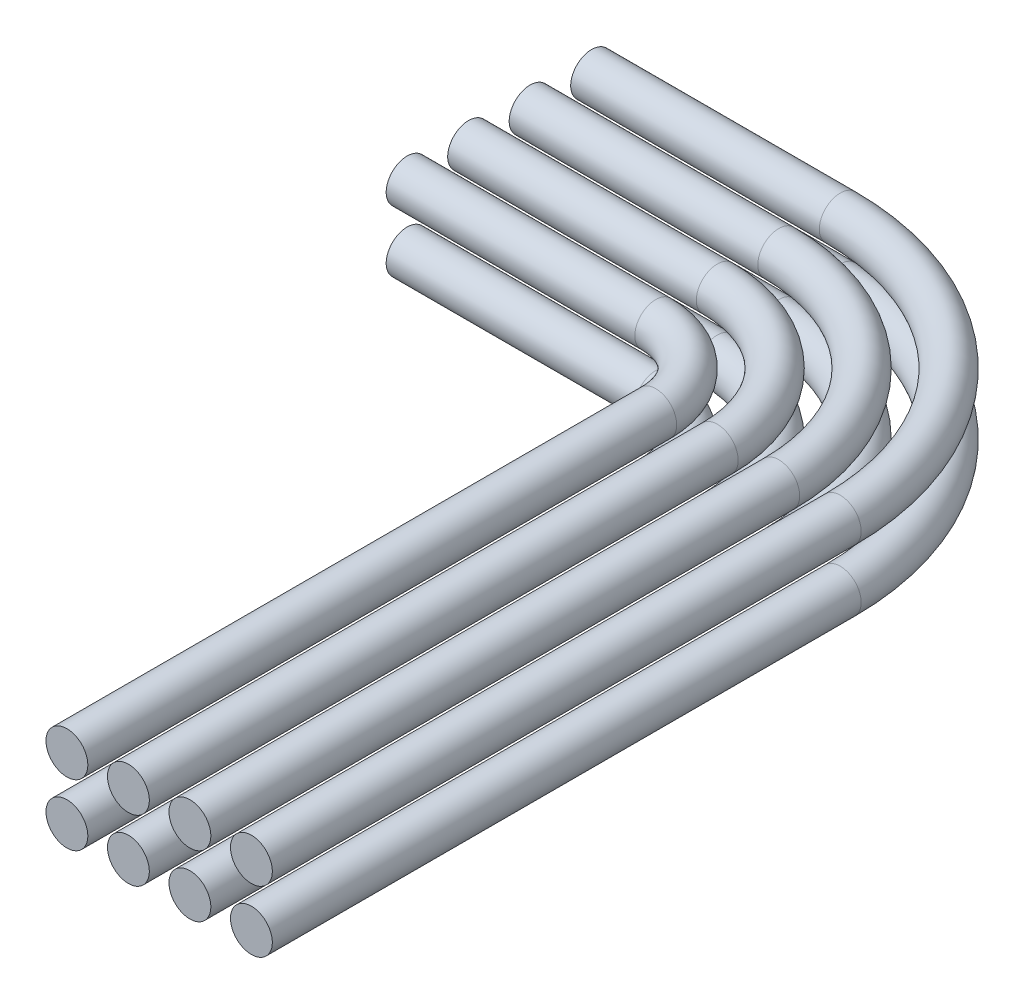
from build123d import *

# Parameters (mm, degrees)
SKETCH2_R       = 1.6
LPATTERN1_COUNT = 2
LPATTERN1_PITCH = 4.7


with BuildPart() as part:
    # Sweep1: sweep along a path in Sketch1
    with BuildLine(Plane(origin=(0, 0, 0), x_dir=(1, 0, 0), z_dir=(0, 1, 0))) as sweep1_path:
        Line((0, 0), (19, 0))
        ThreePointArc((19, 0), (33.142135624, -5.857864376), (39, -20))
        Line((39, -20), (39, -65))
    # Sketch2 → Sweep1 (sweep)
    with BuildSketch(Plane(origin=(0, 0, 0), x_dir=(0, 0, -1), z_dir=(1, 0, 0))):
        Circle(SKETCH2_R)
        with Locations((-4.7, 0)):
            Circle(SKETCH2_R)
        with Locations((-9.4, 0)):
            Circle(SKETCH2_R)
        with Locations((-14.1, 0)):
            Circle(SKETCH2_R)
    sweep1 = sweep(path=sweep1_path.line)


with BuildPart() as lpattern1_1:
    # LPattern1: Sweep1 ×2
    with Locations(*[(0, i * LPATTERN1_PITCH, 0) for i in range(1, LPATTERN1_COUNT)]):
        add(sweep1)


solid = Compound([part.part, lpattern1_1.part])
